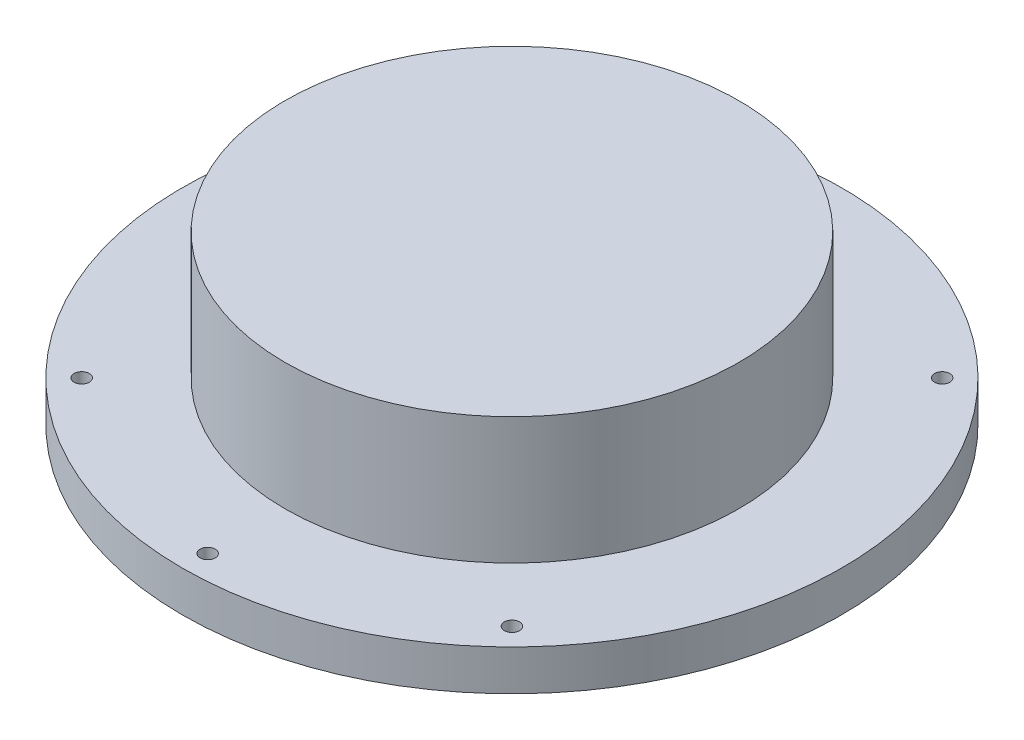
from build123d import *

# Parameters (mm, degrees)
SKETCH1_R           = 65
SKETCH1_R_2         = 1.5
BOSS_EXTRUDE1_DEPTH = 8
SKETCH3_R           = 44.745966538
BOSS_EXTRUDE2_DEPTH = 25


with BuildPart() as part:
    # Sketch1 → Boss-Extrude1 (new body)
    with BuildSketch(Plane(origin=(0, 0, 0), x_dir=(1, 0, 0), z_dir=(0, 1, 0))):
        Circle(SKETCH1_R)
        with Locations((0, -60)):
            Circle(SKETCH1_R_2, mode=Mode.SUBTRACT)
        with Locations((-42.426406871, -42.426406871)):
            Circle(SKETCH1_R_2, mode=Mode.SUBTRACT)
        with Locations((-42.426406871, 42.426406871)):
            Circle(SKETCH1_R_2, mode=Mode.SUBTRACT)
        with Locations((0, 60)):
            Circle(SKETCH1_R_2, mode=Mode.SUBTRACT)
        with Locations((42.426406871, 42.426406871)):
            Circle(SKETCH1_R_2, mode=Mode.SUBTRACT)
        with Locations((42.426406871, -42.426406871)):
            Circle(SKETCH1_R_2, mode=Mode.SUBTRACT)
    extrude(amount=BOSS_EXTRUDE1_DEPTH)

    # Sketch3 → Boss-Extrude2 (add)
    with BuildSketch(Plane(origin=(0, 8, 0), x_dir=(1, 0, 0), z_dir=(0, 1, 0))):
        Circle(SKETCH3_R)
    extrude(amount=BOSS_EXTRUDE2_DEPTH)


solid = part.part
